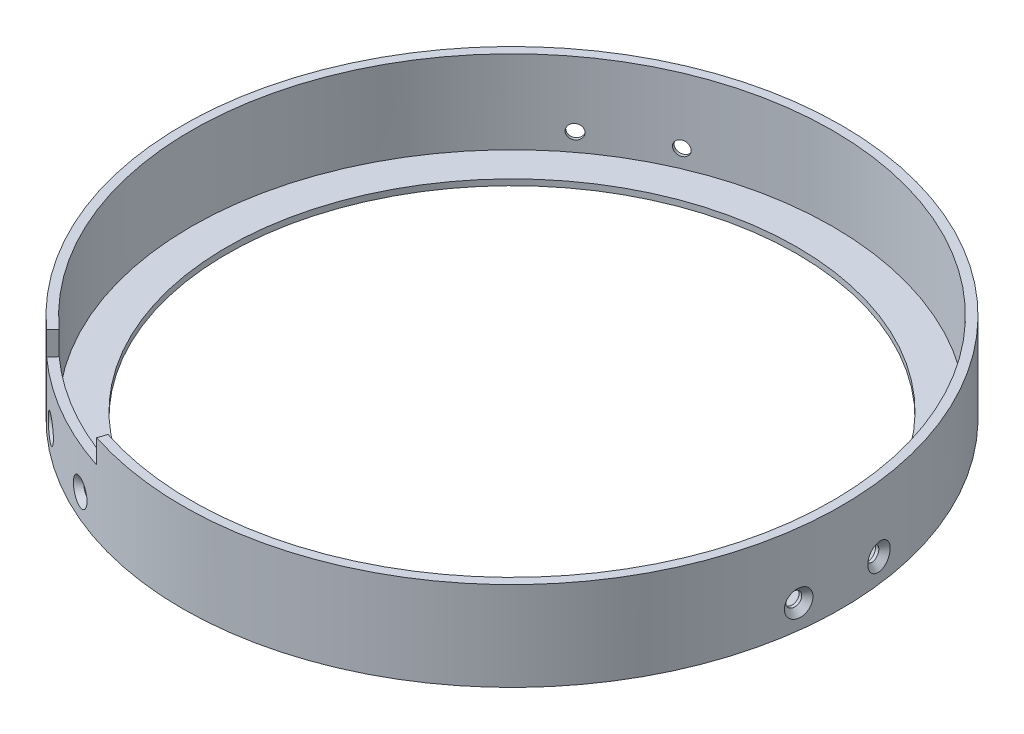
from build123d import *

# Parameters (mm, degrees)
CUT_EXTRUDE2_DEPTH = 4


# Read off the part's stored shape, not the designer's step: CSK for M2 Flat Head Machine Screw1
with BuildPart() as part:
    # Sketch1 → Revolve1 (revolve)
    with BuildSketch(Plane.XY, mode=Mode.PRIVATE) as revolve1_sk:
        Polygon((54, 11), (55.5, 11), (55.5, -4), (48, -4), (48, -3), (54, -3), align=None)
    revolve(revolve1_sk.sketch.rotate(Axis((0, 0, 0), (0, 1, 0)), 90), axis=Axis((0, 0, 0), (0, 1, 0)))

    # Sketch7 → Cut-Extrude2 (cut)
    with BuildSketch(Plane(origin=(0, 11, 0), x_dir=(1, 0, 0), z_dir=(0, 1, 0))):
        with BuildLine():
            Line((-17.150443188, -52.783636654), (-16.686917696, -51.35705188))
            ThreePointArc((-16.686917696, -51.35705188), (-27, -46.765371804), (-36.133052743, -40.129820576))
            Line((-36.133052743, -40.129820576), (-37.136748653, -41.244537814))
            ThreePointArc((-37.136748653, -41.244537814), (-27.75, -48.06440991), (-17.150443188, -52.783636654))
        make_face()
    extrude(amount=-CUT_EXTRUDE2_DEPTH, mode=Mode.SUBTRACT)

    # CSK for M2 Flat Head Machine Screw1 outl → CSK for M2 Flat Head Machine Screw1 (revolve, cut)
    with BuildSketch(Plane(origin=(0, 0, 0), x_dir=(0, 1, 0), z_dir=(-0.121869343405148, 0, -0.992546151641322))):
        Polygon((2.200019656, 55.500019656), (0, 55.500019656), (0, 53.986657854), (1.2, 53.986657854), (1.2, 54.5), align=None)
    revolve(axis=Axis((0, 0, 0), (0.992546151641322, 0, -0.121869343405148)), mode=Mode.SUBTRACT)

    # CSK for M2 Flat Head Machine Screw1 2 ou → CSK for M2 Flat Head Machine Screw1 2 (revolve, cut)
    with BuildSketch(Plane(origin=(0, 0, 0), x_dir=(0, 1, 0), z_dir=(0.12186934340514702, 0, -0.9925461516413221))):
        Polygon((2.200023885, 55.500023885), (0, 55.500023885), (0, 53.986657854), (1.2, 53.986657854), (1.2, 54.5), align=None)
    revolve(axis=Axis((0, 0, 0), (0.9925461516413221, 0, 0.12186934340514702)), mode=Mode.SUBTRACT)

    # CSK for M2 Flat Head Machine Screw1 3 ou → CSK for M2 Flat Head Machine Screw1 3 (revolve, cut)
    with BuildSketch(Plane(origin=(0, 0, 0), x_dir=(0.9205048534524387, 0, -0.3907311284892778), z_dir=(0, -1, 0))):
        Polygon((0, -55.500018568), (2.200018568, -55.500018568), (1.2, -54.5), (1.2, -53.986657854), (0, -53.986657854), align=None)
    revolve(axis=Axis((0, 0, 0), (0.3907311284892778, 0, 0.9205048534524387)), mode=Mode.SUBTRACT)

    # CSK for M2 Flat Head Machine Screw1 4 ou → CSK for M2 Flat Head Machine Screw1 4 (revolve, cut)
    with BuildSketch(Plane(origin=(0, 0, 0), x_dir=(0.79863551004729, 0, -0.601815023152052), z_dir=(0, -1, 0))):
        Polygon((0, -55.500012206), (2.200012206, -55.500012206), (1.2, -54.5), (1.2, -53.986657854), (0, -53.986657854), align=None)
    revolve(axis=Axis((0, 0, 0), (0.601815023152052, 0, 0.79863551004729)), mode=Mode.SUBTRACT)

    # CSK for M2 Flat Head Machine Screw1 5 ou → CSK for M2 Flat Head Machine Screw1 5 (revolve, cut)
    with BuildSketch(Plane(origin=(0, 0, 0), x_dir=(0.9205048534524416, 0, 0.39073112848927083), z_dir=(0, 1, 0))):
        Polygon((0, -55.500018348), (2.200018348, -55.500018348), (1.2, -54.5), (1.2, -53.986657854), (0, -53.986657854), align=None)
    revolve(axis=Axis((0, 0, 0), (0.39073112848927083, 0, -0.9205048534524416)), mode=Mode.SUBTRACT)

    # CSK for M2 Flat Head Machine Screw1 6 ou → CSK for M2 Flat Head Machine Screw1 6 (revolve, cut)
    with BuildSketch(Plane(origin=(0, 0, 0), x_dir=(0.7986355100472992, 0, 0.60181502315204), z_dir=(0, 1, 0))):
        Polygon((0, -55.50002414), (2.20002414, -55.50002414), (1.2, -54.5), (1.2, -53.986657854), (0, -53.986657854), align=None)
    revolve(axis=Axis((0, 0, 0), (0.60181502315204, 0, -0.7986355100472992)), mode=Mode.SUBTRACT)


solid = part.part
